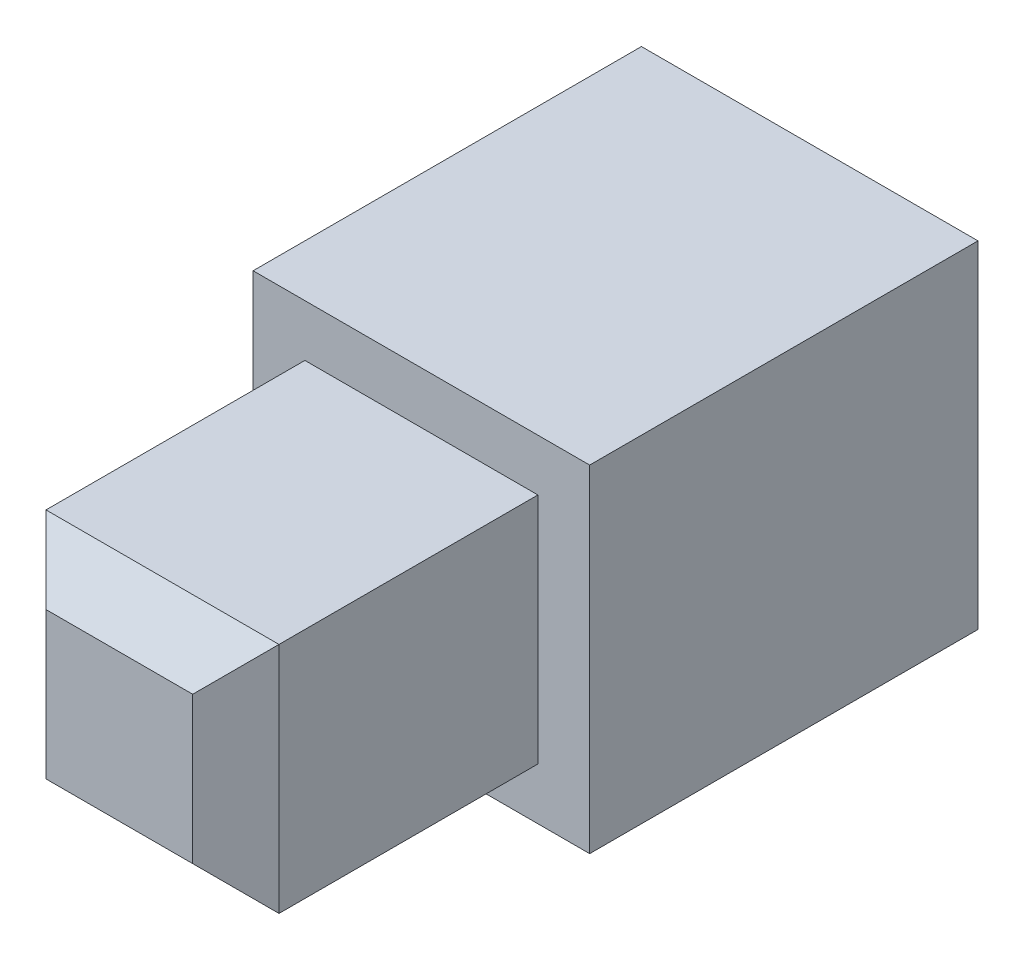
from build123d import *

# Parameters (mm, degrees)
SKETCH2_W           = 7.799999809
SKETCH2_H           = 7.79999981
BOSS_EXTRUDE1_DEPTH = 5
SKETCH3_W           = 7.799999809
SKETCH3_H           = 7.79999981
SKETCH3_W_2         = 6.199999809
SKETCH3_H_2         = 6.19999981
BOSS_EXTRUDE2_DEPTH = 4
SKETCH4_W           = 5.399999809
SKETCH4_H           = 5.39999981
BOSS_EXTRUDE3_DEPTH = 7
CHAMFER1_SIZE       = 1


with BuildPart() as part:
    # Sketch2 → Boss-Extrude1 (new body)
    with BuildSketch(Plane.XY.offset(100.335422766)):
        with Locations((-12.150804877, 90.015849294)):
            Rectangle(SKETCH2_W, SKETCH2_H)
    extrude(amount=BOSS_EXTRUDE1_DEPTH)

    # Sketch3 → Boss-Extrude2 (add)
    with BuildSketch(Plane(origin=(0, 0, 100.335422766), x_dir=(-1, 0, 0), z_dir=(0, 0, -1))):
        with Locations((12.150804877, 90.015849294)):
            Rectangle(SKETCH3_W, SKETCH3_H)
        with Locations((12.150804877, 90.015849294)):
            Rectangle(SKETCH3_W_2, SKETCH3_H_2, mode=Mode.SUBTRACT)
    extrude(amount=BOSS_EXTRUDE2_DEPTH)

    # Sketch4 → Boss-Extrude3 (add)
    with BuildSketch(Plane.XY.offset(105.335422766)):
        with Locations((-12.150804877, 90.015849294)):
            Rectangle(SKETCH4_W, SKETCH4_H)
    extrude(amount=BOSS_EXTRUDE3_DEPTH)

    # Chamfer1
    chamfer1_edges = [part.edges().sort_by_distance(p)[0] for p in [
        (-12.150804876, 92.715849199, 112.335422766),
        (-9.450804972, 90.015849294, 112.335422766),
        (-12.150804876, 87.315849389, 112.335422766),
        (-14.850804781, 90.015849294, 112.335422766),
    ]]
    chamfer(chamfer1_edges, length=CHAMFER1_SIZE)


solid = part.part
